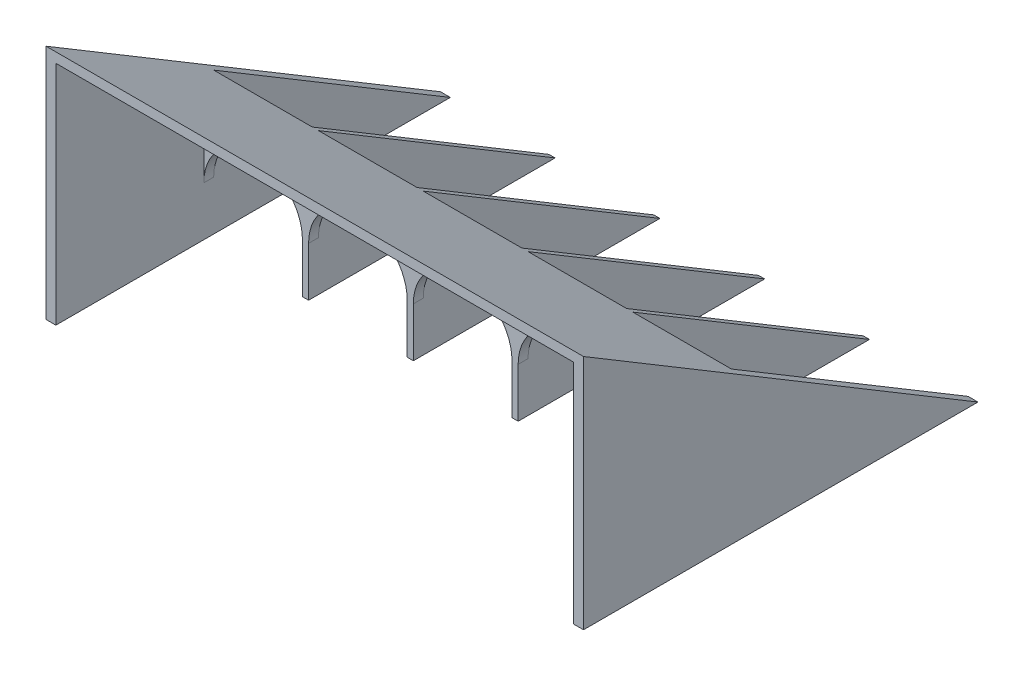
from build123d import *

# Parameters (mm, degrees)
SALIENTE_EXTRUIR1_DEPTH = 218
CROQUIS4_W              = 40.00000000000003
CROQUIS4_H              = 96.00000000000001
CORTAR_EXTRUIR1_DEPTH   = 60
CORTAR_EXTRUIR2_DEPTH   = 4
REDONDEO1_R             = 20


with BuildPart() as part:
    # Croquis2 → Saliente-Extruir1 (new body)
    with BuildSketch(Plane(origin=(0, 0, 0), x_dir=(0, 0, -1), z_dir=(1, 0, 0))):
        Polygon((-60.000000000000014, 35.99999999999998), (-59.99999999999997, -60), (100, -59.99999999999999), align=None)
    extrude(amount=SALIENTE_EXTRUIR1_DEPTH)

    # Croquis3 → Cortar-Recubrir1 section 0
    with BuildSketch(Plane.XY.offset(60)):
        with BuildLine():
            Line((4, 32), (214, 32))
            Line((214, 32), (214, -59.99999999999997))
            Line((214, -59.99999999999997), (4.0000000000000115, -59.99999999999997))
            Line((4.0000000000000115, -59.99999999999997), (4, 32))
        make_face()
    # Croquis3D3 → Cortar-Recubrir1 section 1
    with BuildSketch(Plane(origin=(4, -3.9999999999999964, 0), x_dir=(0.9662349396012463, -0.25766265056033233, 0), z_dir=(0, 0, 1))):
        with BuildLine():
            Line((0, 0), (202.9093373162617, 54.10915661766981))
            Line((202.9093373162617, 54.10915661766981), (217.33844574764032, 0))
            Line((217.33844574764032, 0), (14.42910843137861, -54.1091566176698))
            Line((14.42910843137861, -54.1091566176698), (0, 0))
        make_face()
    loft(mode=Mode.SUBTRACT)

    # Croquis4 → Cortar-Extruir1 (cut)
    with BuildSketch(Plane.XZ.offset(60)):
        Polygon((3.999999999999988, -4), (43.99999999999999, -4), (44.00000000000001, -100), (4, -100), align=None)
        Polygon((46.499999999999986, -4), (86.49999999999999, -4), (86.5, -100), (46.5, -100), align=None)
        Polygon((88.99999999999999, -3.9999999999999973), (128.99999999999997, -3.9999999999999973), (128.99999999999997, -100), (89, -100), align=None)
        with Locations((151.5, -52.00000000000001)):
            Rectangle(CROQUIS4_W, CROQUIS4_H)
        with Locations((194, -52.00000000000001)):
            Rectangle(CROQUIS4_W, CROQUIS4_H)
    extrude(amount=-CORTAR_EXTRUIR1_DEPTH, mode=Mode.SUBTRACT)

    # Croquis5 → Cortar-Extruir2 (cut)
    with BuildSketch(Plane(origin=(0, 1.7e-16, -4), x_dir=(-1, 0, 0), z_dir=(0, 4e-17, -1))):
        Polygon((-194, -60), (-174.00000000000003, -60.00000000000001), (-174.00000000000003, -19.99999999999999), (-214, -19.999999999999996), (-214, -60), align=None)
        Polygon((-151.49999999999997, -60), (-131.49999999999997, -60), (-131.49999999999997, -19.99999999999999), (-171.5, -19.999999999999996), (-171.49999999999997, -60), align=None)
        Polygon((-108.99999999999999, -60), (-88.99999999999999, -60), (-88.99999999999999, -19.999999999999996), (-128.99999999999997, -20), (-128.99999999999997, -60), align=None)
        Polygon((-66.49999999999997, -60), (-46.49999999999997, -60), (-46.49999999999997, -19.999999999999996), (-86.5, -19.999999999999996), (-86.49999999999999, -60), align=None)
        Polygon((-23.99999999999999, -60), (-3.99999999999999, -60), (-3.99999999999999, -19.99999999999999), (-43.99999999999999, -19.999999999999996), (-43.99999999999999, -60), align=None)
    extrude(amount=-CORTAR_EXTRUIR2_DEPTH, mode=Mode.SUBTRACT)

    # Redondeo1
    redondeo1_edges = [part.edges().sort_by_distance(p)[0] for p in [
        (3.99999999999999, -19.99999999999999, -2.000000000000001),
        (43.99999999999999, -19.999999999999996, -2.000000000000001),
        (46.49999999999997, -19.999999999999996, -2.000000000000001),
        (86.5, -19.999999999999996, -2.000000000000001),
        (88.99999999999999, -19.999999999999996, -2.000000000000001),
        (128.99999999999997, -20, -2.000000000000001),
        (131.49999999999997, -19.99999999999999, -2.000000000000001),
        (171.5, -19.999999999999996, -2.000000000000001),
        (174.00000000000003, -19.99999999999999, -2.000000000000001),
        (214, -19.999999999999996, -2.000000000000001),
    ]]
    fillet(redondeo1_edges, radius=REDONDEO1_R - 0.0001)  # a hair under: the kernel refuses the full size


solid = part.part
